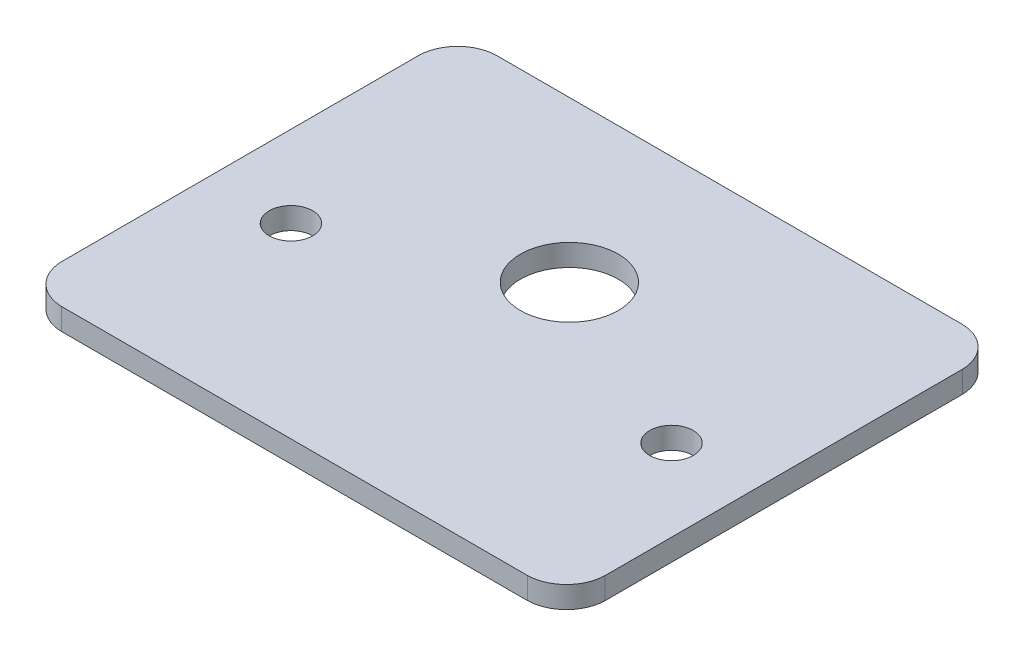
from build123d import *

# Parameters (mm, degrees)
SKETCH1_R           = 2
SKETCH1_R_2         = 4.5
BOSS_EXTRUDE2_DEPTH = 2


with BuildPart() as part:
    # Sketch1 → Boss-Extrude2 (new body)
    with BuildSketch(Plane(origin=(0, 0, 0), x_dir=(1, 0, 0), z_dir=(0, 1, 0))):
        with BuildLine():
            Line((21.446973136, 20), (-21.446973136, 20))
            ThreePointArc((-21.446973136, 20), (-23.935145745, 18.935145745), (-25, 16.446973136))
            Line((-25, 16.446973136), (-25, 16.276952121))
            Line((-25, 16.276952121), (-25, -16.276952121))
            Line((-25, -16.276952121), (-25, -16.446973136))
            ThreePointArc((-25, -16.446973136), (-23.935145745, -18.935145745), (-21.446973136, -20))
            Line((-21.446973136, -20), (21.446973136, -20))
            ThreePointArc((21.446973136, -20), (23.935145745, -18.935145745), (25, -16.446973136))
            Line((25, -16.446973136), (25, -16.276952121))
            Line((25, -16.276952121), (25, 16.276952121))
            Line((25, 16.276952121), (25, 16.446973136))
            ThreePointArc((25, 16.446973136), (23.935145745, 18.935145745), (21.446973136, 20))
        make_face()
        with Locations((-17.507214432, -2.825963154)):
            Circle(SKETCH1_R, mode=Mode.SUBTRACT)
        with Locations((17.492785568, -2.825963154)):
            Circle(SKETCH1_R, mode=Mode.SUBTRACT)
        with Locations((0, 5.276580282)):
            Circle(SKETCH1_R_2, mode=Mode.SUBTRACT)
    extrude(amount=BOSS_EXTRUDE2_DEPTH)


solid = part.part
